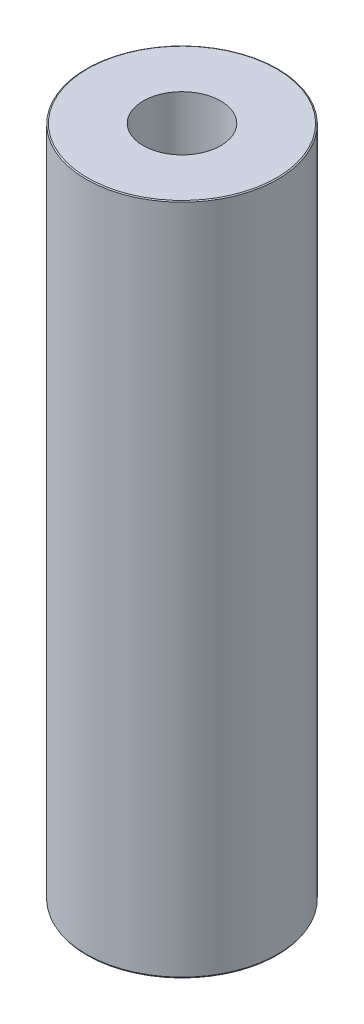
from build123d import *
from OCP.BRepFilletAPI import BRepFilletAPI_MakeChamfer

# Parameters (mm, degrees)
SKETCH1_R           = 60
BOSS_EXTRUDE1_DEPTH = 421.984386098
SKETCH2_R           = 24.306568705
CUT_EXTRUDE1_DEPTH  = 431.430972527
CHAMFER1_SIZE       = 0.433486584
CHAMFER1_SIZE2      = 0.750820787


with BuildPart() as part:
    # Sketch1 → Boss-Extrude1 (new body)
    with BuildSketch(Plane(origin=(0, 0, 0), x_dir=(1, 0, 0), z_dir=(0, 1, 0))):
        Circle(SKETCH1_R)
    extrude(amount=BOSS_EXTRUDE1_DEPTH)

    # Sketch2 → Cut-Extrude1 (cut, through all)
    with BuildSketch(Plane(origin=(0, 0, 0), x_dir=(1, 0, 0), z_dir=(0, 1, 0))):
        Circle(SKETCH2_R)
    extrude(amount=CUT_EXTRUDE1_DEPTH, mode=Mode.SUBTRACT)

    # Chamfer1: one chamfer whose edges measure the first distance from different faces: ONE call of the kernel's chamfer builder (chamfer() names one face for all edges)
    chamfer1_edges_1 = [part.edges().sort_by_distance(p)[0] for p in [
        (-60, 421.984386098, 0),
    ]]
    chamfer1_side_1 = [part.faces().sort_by_distance(p)[0] for p in [
        (-60, 210.992193049, 0),
    ]]
    chamfer1_edges_2 = [part.edges().sort_by_distance(p)[0] for p in [
        (-60, 0, 0),
    ]]
    chamfer1_side_2 = [part.faces().sort_by_distance(p)[0] for p in [
        (-58.302943725, 0, 0),
    ]]
    chamfer1 = BRepFilletAPI_MakeChamfer(part.part.solid().wrapped)
    for e in chamfer1_edges_1:
        chamfer1.Add(CHAMFER1_SIZE, CHAMFER1_SIZE2, e.wrapped, chamfer1_side_1[0].wrapped)  # the first distance lies on this face
    for e in chamfer1_edges_2:
        chamfer1.Add(CHAMFER1_SIZE, CHAMFER1_SIZE2, e.wrapped, chamfer1_side_2[0].wrapped)  # the first distance lies on this face
    add(Compound.cast(chamfer1.Shape()), mode=Mode.REPLACE)


solid = part.part
